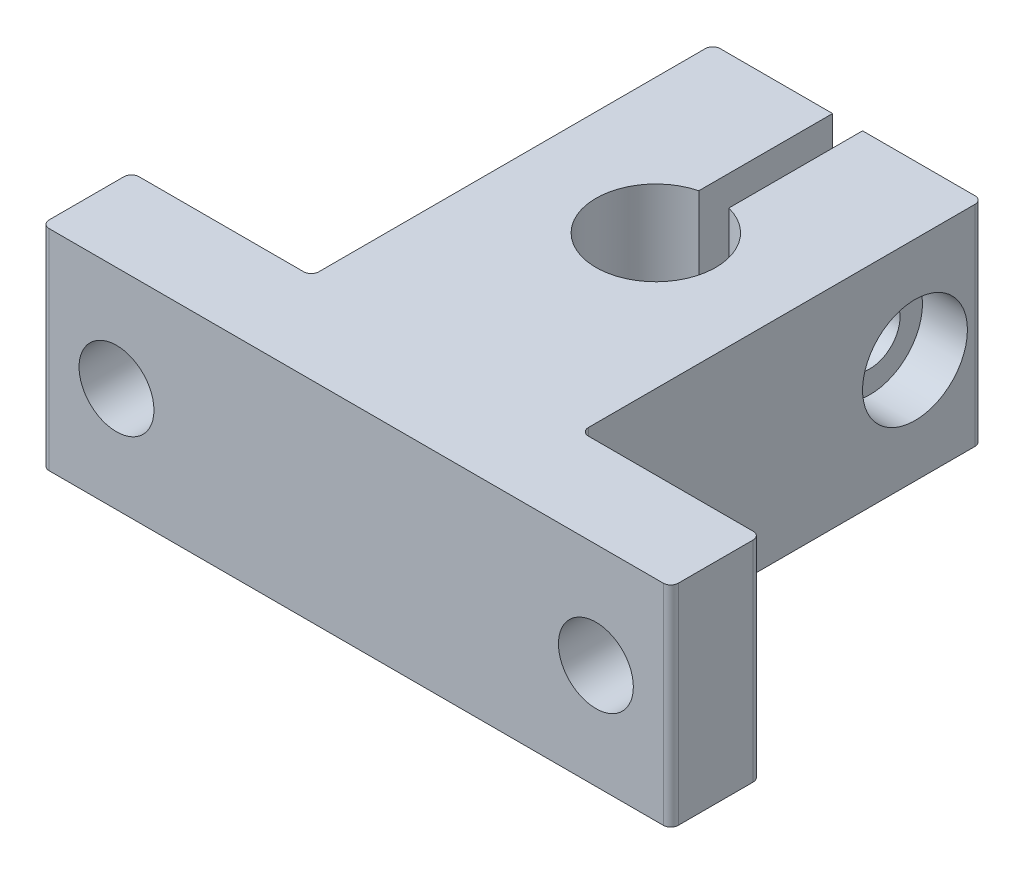
from build123d import *

# Parameters (mm, degrees)
BOSS_EXTRUDE1_DEPTH = 14
SKETCH2_R           = 2
CUT_EXTRUDE1_DEPTH  = 20
SKETCH3_R           = 3.5
CUT_EXTRUDE2_DEPTH  = 3
SKETCH4_R           = 2.5
CUT_EXTRUDE3_DEPTH  = 8
FILLET1_R           = 0.5


with BuildPart() as part:
    # Sketch1 → Boss-Extrude1 (new body)
    with BuildSketch(Plane(origin=(0, 0, 0), x_dir=(1, 0, 0), z_dir=(0, 1, 0))):
        with BuildLine():
            Line((9, -14), (21, -14))
            Line((21, -14), (21, -20))
            Line((21, -20), (-21, -20))
            Line((-21, -20), (-21, -14))
            Line((-21, -14), (-9, -14))
            Line((-9, -14), (-9, 12.8))
            Line((-9, 12.8), (-1, 12.8))
            Line((-1, 12.8), (-1, 3.872983346))
            ThreePointArc((-1, 3.872983346), (0, -4), (1, 3.872983346))
            Line((1, 3.872983346), (1, 12.8))
            Line((1, 12.8), (9, 12.8))
            Line((9, 12.8), (9, -14))
        make_face()
    extrude(amount=BOSS_EXTRUDE1_DEPTH)

    # Sketch2 → Cut-Extrude1 (cut)
    with BuildSketch(Plane(origin=(9, 0, 0), x_dir=(0, 0, -1), z_dir=(1, 0, 0))):
        with Locations((8.3, 7)):
            Circle(SKETCH2_R)
    extrude(amount=-CUT_EXTRUDE1_DEPTH, mode=Mode.SUBTRACT)

    # Sketch3 → Cut-Extrude2 (cut)
    with BuildSketch(Plane(origin=(9, 0, 0), x_dir=(0, 0, -1), z_dir=(1, 0, 0))):
        with Locations((8.3, 7)):
            Circle(SKETCH3_R)
    extrude(amount=-CUT_EXTRUDE2_DEPTH, mode=Mode.SUBTRACT)

    # Sketch4 → Cut-Extrude3 (cut)
    with BuildSketch(Plane.XY.offset(20)):
        with Locations((-16, 7)):
            Circle(SKETCH4_R)
        with Locations((16, 7)):
            Circle(SKETCH4_R)
    extrude(amount=-CUT_EXTRUDE3_DEPTH, mode=Mode.SUBTRACT)

    # Fillet1
    fillet1_edges = [part.edges().sort_by_distance(p)[0] for p in [
        (9, 7, 14),
        (-9, 7, 14),
        (-9, 7, -12.8),
        (9, 7, -12.8),
        (21, 7, 14),
        (21, 7, 20),
        (-21, 7, 20),
        (-21, 7, 14),
    ]]
    fillet(fillet1_edges, radius=FILLET1_R)


solid = part.part
